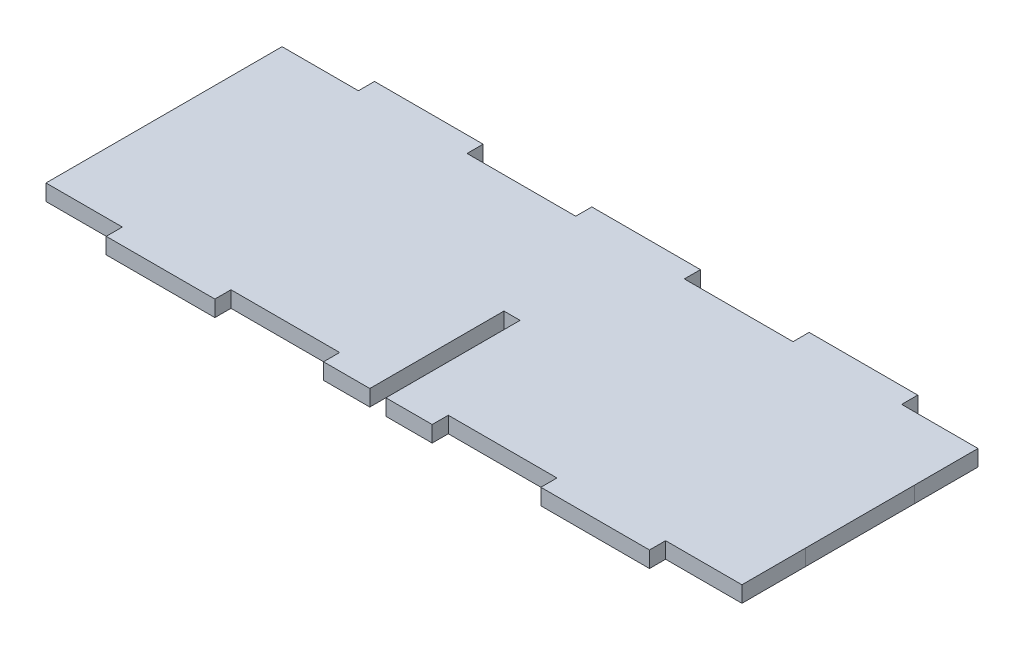
from build123d import *

# Parameters (mm, degrees)
SKETCH1_W                   = 515.597416032
SKETCH1_H                   = 317.102213092
BOSS_EXTRUDE1_DEPTH         = 6
CUT_EXTRUDE_THIN1_START     = -6
CUT_EXTRUDE_THIN1_OUTLINE_W = 515.597416032
CUT_EXTRUDE_THIN1_OUTLINE_H = 317.102213092
CUT_EXTRUDE_THIN1_DEPTH     = 6


# Read off the part's stored shape, not the designer's step: Cut-Extrude-Thin1
with BuildPart() as part:
    # Sketch1 → Boss-Extrude1 (new body)
    with BuildSketch(Plane(origin=(0, 0, 0), x_dir=(1, 0, 0), z_dir=(0, 1, 0))):
        Rectangle(SKETCH1_W, SKETCH1_H)
    extrude(amount=BOSS_EXTRUDE1_DEPTH)

    # Cut-Extrude-Thin1 outline → Cut-Extrude-Thin1 (cut)
    with BuildSketch(Plane(origin=(0, 6, 0), x_dir=(1, 0, 0), z_dir=(0, 1, 0)).offset(CUT_EXTRUDE_THIN1_START)):
        Rectangle(CUT_EXTRUDE_THIN1_OUTLINE_W, CUT_EXTRUDE_THIN1_OUTLINE_H)
        with BuildLine():
            add(Edge.make_bspline(
                [(84.819466733, 25.244885548), (84.821389699, 29.41155314), (84.819617483, 33.578221619), (84.819636894, 37.744889655), (84.819695129, 50.244893831), (84.819695129, 62.744898008), (84.819695129, 75.244902185)],
                knots=[0, 0, 0, 0, 0.012500004, 0.012500004, 0.012500004, 0.050000017, 0.050000017, 0.050000017, 0.050000017], degree=3))
            Line((84.819466733, 25.244885548), (67.579926926, 25.244885548))
            Line((67.579926926, 25.244885548), (67.579926926, 31.244916231))
            Line((67.579926926, 31.244916231), (27.06992581, 31.244916231))
            Line((27.06992581, 31.244916231), (27.06992581, 25.244885548))
            Line((27.06992581, 25.244885548), (-13.420075307, 25.244885548))
            Line((-13.420075307, 25.244885548), (-13.420075307, 31.244916231))
            Line((-13.420075307, 31.244916231), (-41.87677177, 31.244916231))
            Line((-41.87677177, 31.244916231), (-41.87677177, 54.984916885))
            Line((-41.87677177, 54.984916885), (-41.875093181, 54.984916885))
            Line((-41.875093181, 54.984916885), (-41.875093181, 95.494918002))
            Line((-41.875093181, 95.494918002), (-41.87677177, 95.494918002))
            Line((-41.87677177, 95.494918002), (-41.87677177, 119.234918656))
            Line((-41.87677177, 119.234918656), (-13.420075307, 119.234918656))
            Line((-13.420075307, 119.234918656), (-13.420075307, 125.234918822))
            Line((-13.420075307, 125.234918822), (27.06992581, 125.234918822))
            Line((27.06992581, 125.234918822), (27.06992581, 119.234918656))
            Line((27.06992581, 119.234918656), (67.579926926, 119.234918656))
            Line((67.579926926, 119.234918656), (67.579926926, 125.234918822))
            Line((67.579926926, 125.234918822), (108.069928043, 125.234918822))
            Line((108.069928043, 125.234918822), (108.069928043, 119.234918656))
            Line((108.069928043, 119.234918656), (148.579929159, 119.234918656))
            Line((148.579929159, 119.234918656), (148.579929159, 125.234918822))
            Line((148.579929159, 125.234918822), (189.069930275, 125.234918822))
            Line((189.069930275, 125.234918822), (189.069930275, 119.234918656))
            Line((189.069930275, 119.234918656), (217.526162193, 119.234918656))
            Line((217.526162193, 119.234918656), (217.526162193, 95.494918002))
            Line((217.526162193, 95.494918002), (217.524917632, 95.494918002))
            Line((217.524917632, 95.494918002), (217.524917632, 54.984916885))
            Line((217.524917632, 54.984916885), (217.526162193, 54.984916885))
            Line((217.526162193, 54.984916885), (217.526162193, 31.244916231))
            Line((217.526162193, 31.244916231), (189.069930275, 31.244916231))
            Line((189.069930275, 31.244916231), (189.069930275, 25.244885548))
            Line((189.069930275, 25.244885548), (148.579929159, 25.244885548))
            Line((148.579929159, 25.244885548), (148.579929159, 31.244916231))
            Line((148.579929159, 31.244916231), (108.069928043, 31.244916231))
            Line((108.069928043, 31.244916231), (108.069928043, 25.244885548))
            Line((108.069928043, 25.244885548), (90.829695294, 25.244885548))
            Line((90.829695294, 25.244885548), (90.829695294, 75.244902185))
            Line((90.829695294, 75.244902185), (84.819695129, 75.244902185))
        make_face(mode=Mode.SUBTRACT)
    extrude(amount=CUT_EXTRUDE_THIN1_DEPTH, mode=Mode.SUBTRACT)


solid = part.part
